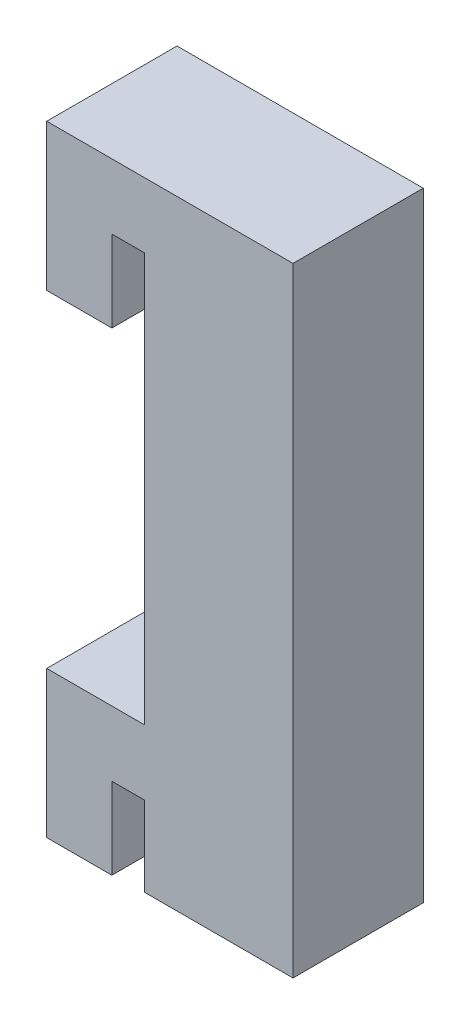
from build123d import *

# Parameters (mm, degrees)
BOSS_EXTRU_1_DEPTH = 8


with BuildPart() as part:
    # Esquisse1 → Boss.-Extru.1 (new body)
    with BuildSketch(Plane.XY):
        Polygon((0, 0), (0, 5), (2, 5), (2, 0.09638948), (11.121873618, 0.09638948), (11.121873618, 38.1), (-4, 38.1), (-4, 29.1), (0, 29.1), (0, 34.1), (2, 34.1), (2, 9), (-4, 9), (-4, 0), align=None)
    extrude(amount=BOSS_EXTRU_1_DEPTH)


solid = part.part
